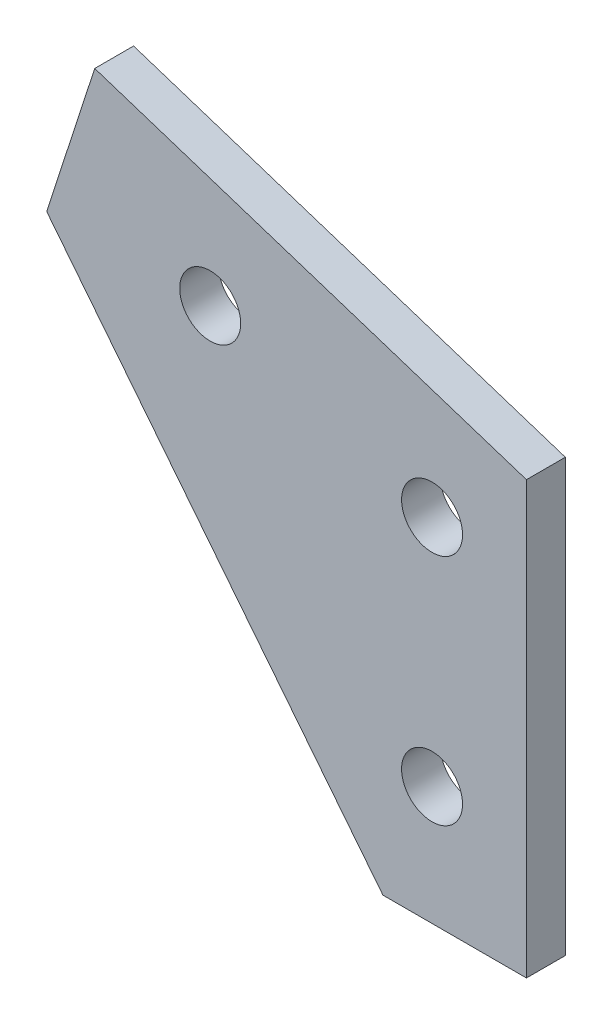
from build123d import *

# Parameters (mm, degrees)
BOSS_EXTRUDE1_DEPTH    = 3.175
F_10_CLEARANCE_HOLE1_D = 4.9784


with BuildPart() as part:
    # Sketch4 → Boss-Extrude1 (new body)
    with BuildSketch(Plane.XY):
        Polygon((-42.954209552, 292.801454104), (-7.698379745, 281.346140593), (-7.698379745, 246.102906618), (-19.418956281, 246.102906618), (-46.878725381, 280.723036347), align=None)
    extrude(amount=BOSS_EXTRUDE1_DEPTH)

    # #10 Clearance Hole1 (through all)
    with Locations(Plane.XY.offset(3.175)):
        with Locations((-33.525155133, 280.723036347), (-15.407528498, 274.836262604), (-15.407528498, 255.786262604)):
            Hole(F_10_CLEARANCE_HOLE1_D / 2)


solid = part.part
